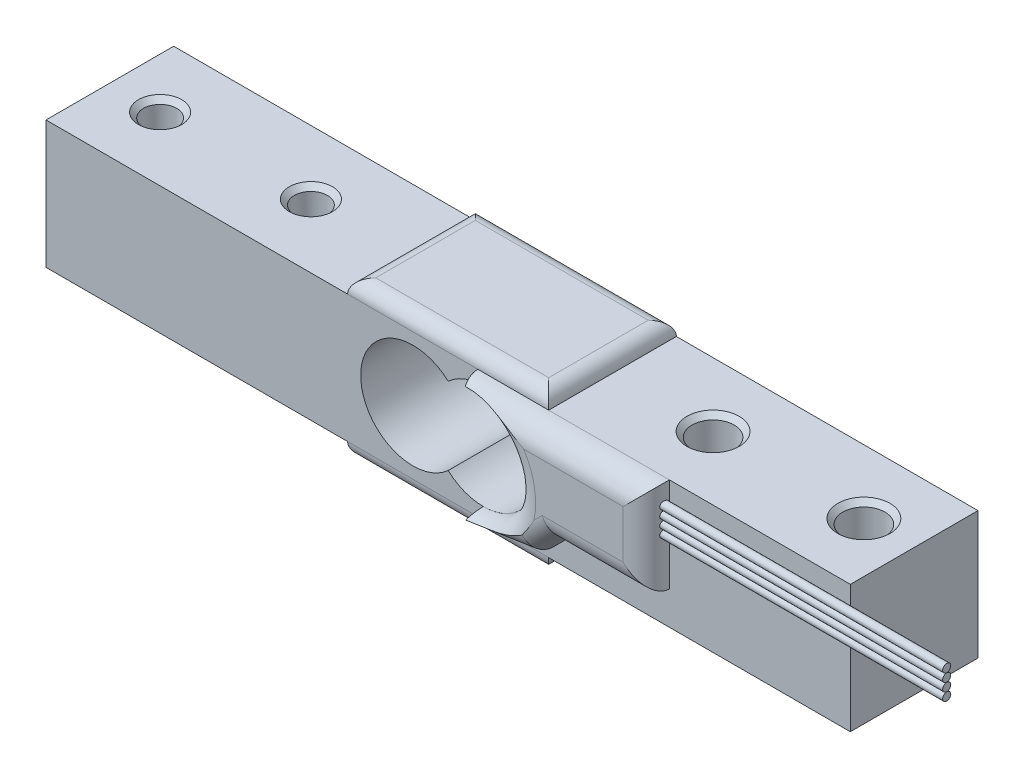
from build123d import *

# Parameters (mm, degrees)
SKETCH_1_W         = 80
SKETCH_1_H         = 12.7
EXTRUDE_1_DEPTH    = 6.35
HOLE_WIZARD_M4_1_D = 3.3
HOLE_WIZARD_M5_1_D = 4.2
CHAMFER_1_SIZE     = 0.5
SKETCH_2_W         = 20
SKETCH_2_H         = 1.4
EXTRUDE_2_DEPTH    = 6.35
EXTRUDE_2_2_DEPTH  = 6.35
FILLET_1_R         = 1.4
FILLET_2_R         = 1.4
EXTRUDE_3_DEPTH    = 2.3
FILLET_3_R         = 2.3
SKETCH_7_R         = 0.4
EXTRUDE_4_DEPTH    = 30


# Some blends are built 0.0001 mm under size
with BuildPart() as part:
    # 草图1 → 凸台-拉伸1 (new, symmetric)
    with BuildSketch(Plane.XY):
        Rectangle(SKETCH_1_W, SKETCH_1_H)
        with BuildLine():
            ThreePointArc((0, 3.845776905), (-8.7, 0), (0, -3.845776905))
            ThreePointArc((0, -3.845776905), (8.7, 0), (0, 3.845776905))
        make_face(mode=Mode.SUBTRACT)
    extrude(amount=EXTRUDE_1_DEPTH, both=True)

    # M4 螺纹孔1 (through all)
    with Locations(Plane(origin=(-35, 6.35, 0), x_dir=(1, 0, 0), z_dir=(0, 1, 0))):
        with Locations((0, 0), (15, 0)):
            Hole(HOLE_WIZARD_M4_1_D / 2)

    # M5 螺纹孔1 (through all)
    with Locations(Plane(origin=(20, 6.35, 0), x_dir=(1, 0, 0), z_dir=(0, 1, 0))):
        with Locations((0, 0), (15, 0)):
            Hole(HOLE_WIZARD_M5_1_D / 2)

    # 倒角1
    chamfer_1_edges = [part.edges().sort_by_distance(p)[0] for p in [
        (-18.35, 6.35, 0),
        (-18.35, -6.35, 0),
        (-33.35, 6.35, 0),
        (-33.35, -6.35, 0),
        (37.1, 6.35, 0),
        (37.1, -6.35, 0),
        (22.1, 6.35, 0),
        (22.1, -6.35, 0),
    ]]
    chamfer(chamfer_1_edges, length=CHAMFER_1_SIZE)


with BuildPart() as body_2:
    # 草图2 → 凸台-拉伸2 (new, symmetric)
    with BuildSketch(Plane.XY):
        with Locations((0, 7.05)):
            Rectangle(SKETCH_2_W, SKETCH_2_H)
    extrude(amount=EXTRUDE_2_DEPTH, both=True)

    # 圆角1
    fillet_1_edges = [body_2.edges().sort_by_distance(p)[0] for p in [
        (10, 7.75, 0),
        (0, 7.75, 6.35),
        (-10, 7.75, 0),
        (0, 7.75, -6.35),
    ]]
    fillet(fillet_1_edges, radius=FILLET_1_R - 0.0001)  # a hair under: the kernel refuses the full size


with BuildPart() as body_3:
    # 草图2 → Extrude 2 2 (new, symmetric)
    with BuildSketch(Plane.XY):
        with Locations((0, -7.05)):
            Rectangle(SKETCH_2_W, SKETCH_2_H)
    extrude(amount=EXTRUDE_2_2_DEPTH, both=True)

    # 圆角2
    fillet_2_edges = [body_3.edges().sort_by_distance(p)[0] for p in [
        (-10, -7.75, 0),
        (0, -7.75, 6.35),
        (10, -7.75, 0),
        (0, -7.75, -6.35),
    ]]
    fillet(fillet_2_edges, radius=FILLET_2_R - 0.0001)  # a hair under: the kernel refuses the full size


with BuildPart() as body_4:
    # 草图6 → 凸台-拉伸3 (new body)
    with BuildSketch(Plane.XY.offset(6.35)):
        with BuildLine():
            Line((3.5, 5.2), (2.947012589, 6.35))
            Line((2.947012589, 6.35), (22, 6.35))
            Line((22, 6.35), (22, -3.05))
            Line((22, -3.05), (12.6, -3.05))
            Line((12.6, -3.05), (10.45, -5.2))
            Line((10.45, -5.2), (2.947012589, -6.35))
            Line((2.947012589, -6.35), (3.5, -5.2))
            ThreePointArc((3.5, -5.2), (8.7, 0), (3.5, 5.2))
        make_face()
    extrude(amount=EXTRUDE_3_DEPTH)

    # 圆角3
    # the kernel refuses this fillet: 2.3 mm, written as the material it takes off along each edge
    with BuildSketch(Plane(origin=(-2.802987411, 6.35, 8.65), x_dir=(0, 0, -1), z_dir=(1, 0, 0))) as fillet_3_piece_1:
        with BuildLine():
            CenterArc((FILLET_3_R, -FILLET_3_R), FILLET_3_R, 90, 90)
            Line((0, -FILLET_3_R), (0, 0))
            Line((0, 0), (FILLET_3_R, 0))
        make_face()
    extrude(amount=30.552987411, mode=Mode.SUBTRACT)
    with BuildSketch(Plane(origin=(22, 12.1, 8.65), x_dir=(0, 0, -1), z_dir=(0, -1, 0))) as fillet_3_piece_2:
        with BuildLine():
            CenterArc((FILLET_3_R, -FILLET_3_R), FILLET_3_R, 90, 90)
            Line((0, -FILLET_3_R), (0, 0))
            Line((0, 0), (FILLET_3_R, 0))
        make_face()
    extrude(amount=20.9, mode=Mode.SUBTRACT)
    with BuildSketch(Plane(origin=(27.75, -3.05, 8.65), x_dir=(0, 0, -1), z_dir=(-1, 0, 0))) as fillet_3_piece_3_section:
        with BuildLine():
            CenterArc((FILLET_3_R, -FILLET_3_R), FILLET_3_R, 90, 90)
            Line((0, -FILLET_3_R), (0, 0))
            Line((0, 0), (FILLET_3_R, 0))
        make_face()
    fillet_3_piece_3 = extrude(amount=20.9, mode=Mode.PRIVATE)
    fillet_3_piece_3 = split(fillet_3_piece_3, bisect_by=Plane(origin=(16.765426993, 1.115426993, 8.1193628), z_dir=(0.707106781186559, -0.707106781186536, 0)), keep=Keep.TOP, mode=Mode.PRIVATE)
    add(fillet_3_piece_3, mode=Mode.SUBTRACT)
    with BuildSketch(Plane(origin=(16.665863992, 1.015863992, 8.65), x_dir=(0, 0, -1), z_dir=(-0.707106781186536, -0.707106781186559, 0))) as fillet_3_piece_4_section:
        with BuildLine():
            CenterArc((FILLET_3_R, -FILLET_3_R), FILLET_3_R, 90, 90)
            Line((0, -FILLET_3_R), (0, 0))
            Line((0, 0), (FILLET_3_R, 0))
        make_face()
    fillet_3_piece_4 = extrude(amount=14.540559159, mode=Mode.PRIVATE)
    fillet_3_piece_4 = split(fillet_3_piece_4, bisect_by=Plane(origin=(8.971306225, -3.05, 8.111727921), z_dir=(0, -1, 0)), keep=Keep.TOP, mode=Mode.PRIVATE)
    add(fillet_3_piece_4, mode=Mode.SUBTRACT)
    with BuildSketch(Plane(origin=(3.5, 0, 8.65), x_dir=(-0.8946054681964377, -0.4468568632940896, 0), z_dir=(-0.4468568632940896, 0.8946054681964377, 0))) as fillet_3_piece_5:
        with BuildLine():
            CenterArc((5.2 + FILLET_3_R, -FILLET_3_R), FILLET_3_R, 90, 90)
            Line((5.2 + FILLET_3_R, 0), (5.2, 0))
            Line((5.2, 0), (5.2, -FILLET_3_R))
        make_face()
    revolve(axis=Axis((3.5, 0, 8.65), (0, 0, 1)), revolution_arc=306.915596643, mode=Mode.SUBTRACT)
    with BuildSketch(Plane(origin=(16.133626562, -4.328857589, 8.65), x_dir=(0, 0, -1), z_dir=(-0.9884567934324736, -0.15150302807928417, 0))) as fillet_3_piece_6:
        with BuildLine():
            CenterArc((FILLET_3_R, -FILLET_3_R), FILLET_3_R, 90, 90)
            Line((0, -FILLET_3_R), (0, 0))
            Line((0, 0), (FILLET_3_R, 0))
        make_face()
    extrude(amount=19.09060736, mode=Mode.SUBTRACT)
    with BuildSketch(Plane(origin=(27.75, -3.05, 8.65), x_dir=(0, 0, -1), z_dir=(-1, 0, 0))) as fillet_3_piece_7a_section:
        with BuildLine():
            CenterArc((FILLET_3_R, -FILLET_3_R), FILLET_3_R, 90, 90)
            Line((0, -FILLET_3_R), (0, 0))
            Line((0, 0), (FILLET_3_R, 0))
        make_face()
    fillet_3_piece_7a = extrude(amount=20.9, mode=Mode.PRIVATE)
    fillet_3_piece_7a = split(fillet_3_piece_7a, bisect_by=Plane(origin=(11.582437507, -4.067562493, 8.15245385), z_dir=(-0.707106781186559, 0.707106781186536, 0)), keep=Keep.TOP, mode=Mode.PRIVATE)
    with BuildSketch(Plane(origin=(16.665863992, 1.015863992, 8.65), x_dir=(0, 0, -1), z_dir=(-0.707106781186536, -0.707106781186559, 0))) as fillet_3_piece_7b_section:
        with BuildLine():
            CenterArc((FILLET_3_R, -FILLET_3_R), FILLET_3_R, 90, 90)
            Line((0, -FILLET_3_R), (0, 0))
            Line((0, 0), (FILLET_3_R, 0))
        make_face()
    fillet_3_piece_7b = extrude(amount=14.540559159, mode=Mode.PRIVATE)
    fillet_3_piece_7b = split(fillet_3_piece_7b, bisect_by=Plane(origin=(14.039050678, -3.05, 8.15245385), z_dir=(0, 1, 0)), keep=Keep.TOP, mode=Mode.PRIVATE)
    fillet_3_piece_7 = fillet_3_piece_7a & fillet_3_piece_7b
    add(fillet_3_piece_7, mode=Mode.SUBTRACT)

    # 草图7 → 凸台-拉伸4 (add)
    with BuildSketch(Plane(origin=(20, 0, 0), x_dir=(0, 0, -1), z_dir=(1, 0, 0))):
        with Locations(Location((-6.76, 4.35, 0), (0, 0, 180))):
            Circle(SKETCH_7_R)
        with Locations(Location((-6.76, 3.53, 0), (0, 0, 180))):
            Circle(SKETCH_7_R)
        with Locations(Location((-6.76, 2.71, 0), (0, 0, 180))):
            Circle(SKETCH_7_R)
        with Locations(Location((-6.76, 1.89, 0), (0, 0, 180))):
            Circle(SKETCH_7_R)
    extrude(amount=EXTRUDE_4_DEPTH)


solid = Compound([part.part, body_2.part, body_3.part, body_4.part])
